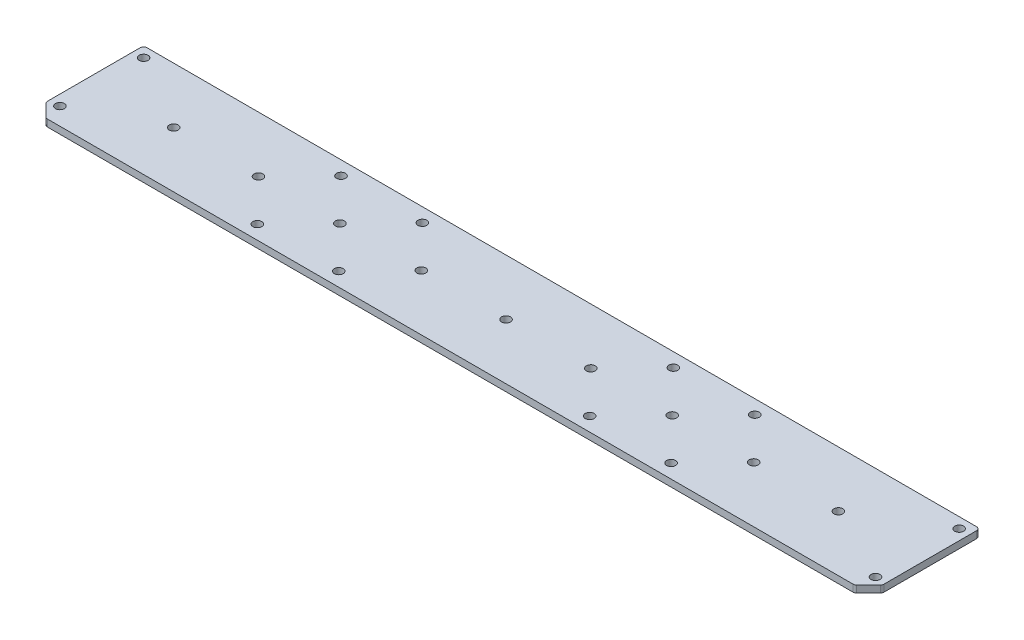
from build123d import *

# Parameters (mm, degrees)
BOSS_EXTRUDE1_DEPTH = 3.175
SKETCH3_R           = 2.032
CUT_EXTRUDE1_DEPTH  = 385.384860036
FILLET1_R           = 1.5875


with BuildPart() as part:
    # Sketch2 → Boss-Extrude1 (new body)
    with BuildSketch(Plane(origin=(0, 0, 0), x_dir=(1, 0, 0), z_dir=(0, 1, 0))):
        with BuildLine():
            Line((0, 7.00756403), (0, 50.8))
            Line((0, 50.8), (381, 50.8))
            Line((381, 50.8), (381, 7.00756403))
            ThreePointArc((381, 7.00756403), (380.879158758, 6.400054081), (380.535032015, 5.885032015))
            Line((380.535032015, 5.885032015), (375.114967985, 0.464967985))
            ThreePointArc((375.114967985, 0.464967985), (374.599945919, 0.120841242), (373.99243597, 0))
            Line((373.99243597, 0), (7.00756403, 0))
            ThreePointArc((7.00756403, 0), (6.400054081, 0.120841242), (5.885032015, 0.464967985))
            Line((5.885032015, 0.464967985), (0.464967985, 5.885032015))
            ThreePointArc((0.464967985, 5.885032015), (0.120841242, 6.400054081), (0, 7.00756403))
        make_face()
    extrude(amount=BOSS_EXTRUDE1_DEPTH)

    # Sketch3 → Cut-Extrude1 (cut, through all)
    with BuildSketch(Plane(origin=(0, 0, 0), x_dir=(1, 0, 0), z_dir=(0, 1, 0))):
        with Locations((4.7625, 7.9375)):
            Circle(SKETCH3_R)
        with Locations((4.7625, 46.0375)):
            Circle(SKETCH3_R)
        with Locations((376.2375, 7.9375)):
            Circle(SKETCH3_R)
        with Locations((376.2375, 46.0375)):
            Circle(SKETCH3_R)
        with Locations((341.884, 25.4)):
            Circle(SKETCH3_R)
        with Locations((247.65, 44.45)):
            Circle(SKETCH3_R)
        with Locations((284.734, 44.45)):
            Circle(SKETCH3_R)
        with Locations((247.65, 6.35)):
            Circle(SKETCH3_R)
        with Locations((284.734, 6.35)):
            Circle(SKETCH3_R)
        with Locations((190.5, 25.4)):
            Circle(SKETCH3_R)
        with Locations((133.35, 44.45)):
            Circle(SKETCH3_R)
        with Locations((96.266, 44.45)):
            Circle(SKETCH3_R)
        with Locations((96.266, 6.35)):
            Circle(SKETCH3_R)
        with Locations((77.724, 25.4)):
            Circle(SKETCH3_R)
        with Locations((39.116, 25.4)):
            Circle(SKETCH3_R)
        with Locations((151.892, 25.4)):
            Circle(SKETCH3_R)
        with Locations((229.108, 25.4)):
            Circle(SKETCH3_R)
        with Locations((266.192, 25.4)):
            Circle(SKETCH3_R)
        with Locations((303.276, 25.4)):
            Circle(SKETCH3_R)
        with Locations((133.35, 6.35)):
            Circle(SKETCH3_R)
        with Locations((114.808, 25.4)):
            Circle(SKETCH3_R)
    extrude(amount=CUT_EXTRUDE1_DEPTH, mode=Mode.SUBTRACT)

    # Fillet1
    fillet1_edges = [part.edges().sort_by_distance(p)[0] for p in [
        (0, 1.5875, -50.8),
        (381, 1.5875, -50.8),
    ]]
    fillet(fillet1_edges, radius=FILLET1_R)


solid = part.part
